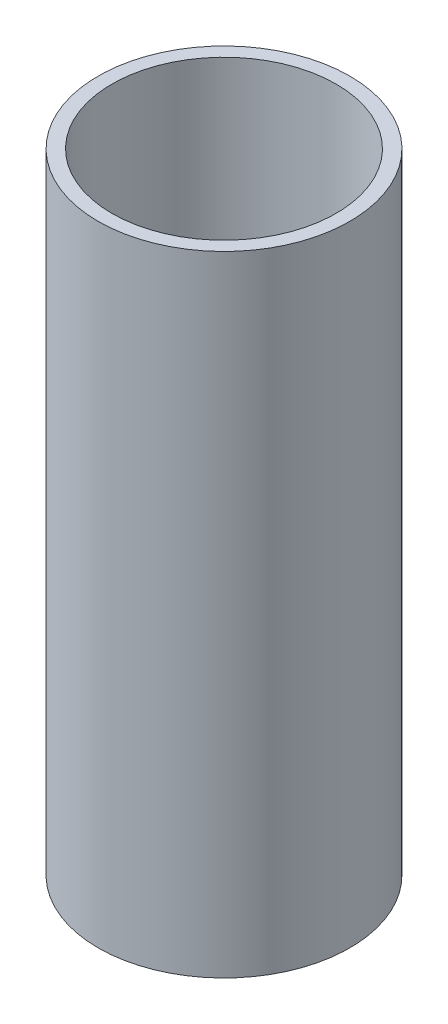
from build123d import *

# Parameters (mm, degrees)
SKETCH1_R           = 16
SKETCH1_R_2         = 14.25
BOSS_EXTRUDE1_DEPTH = 80


with BuildPart() as part:
    # Sketch1 → Boss-Extrude1 (new body)
    with BuildSketch(Plane(origin=(0, 0, 0), x_dir=(1, 0, 0), z_dir=(0, 1, 0))):
        Circle(SKETCH1_R)
        Circle(SKETCH1_R_2, mode=Mode.SUBTRACT)
    extrude(amount=BOSS_EXTRUDE1_DEPTH)


solid = part.part
